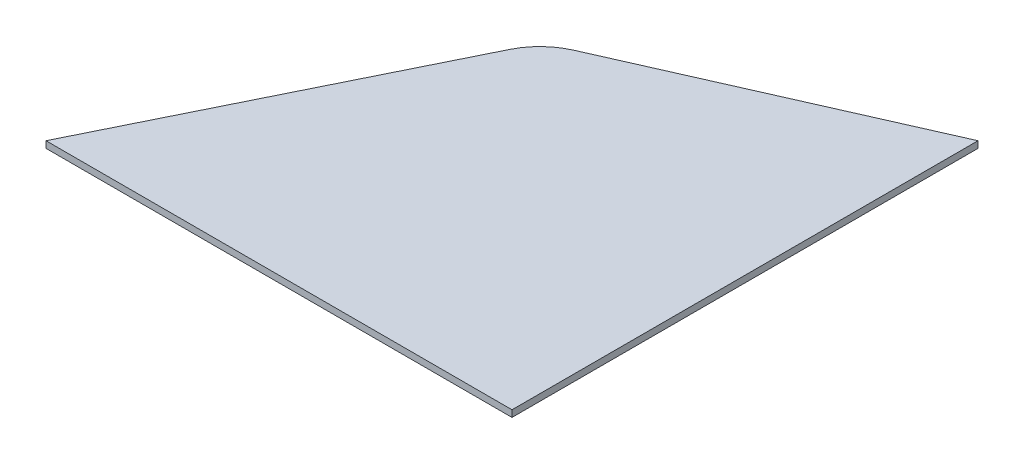
from build123d import *

# Parameters (mm, degrees)
RESSALTO_EXTRUS_O1_DEPTH = 1
FILETE1_R                = 10


with BuildPart() as part:
    # Esboço1 → Ressalto-extrusão1 (new body)
    with BuildSketch(Plane(origin=(0, 0, 0), x_dir=(1, 0, 0), z_dir=(0, 1, 0))):
        Polygon((0, 0), (70, 0), (70, 70), (24.544299076, 49.952139866), align=None)
    extrude(amount=RESSALTO_EXTRUS_O1_DEPTH)

    # Filete1
    filete1_edges = [part.edges().sort_by_distance(p)[0] for p in [
        (24.544299076, 0.5, -49.952139866),
    ]]
    fillet(filete1_edges, radius=FILETE1_R)


solid = part.part
